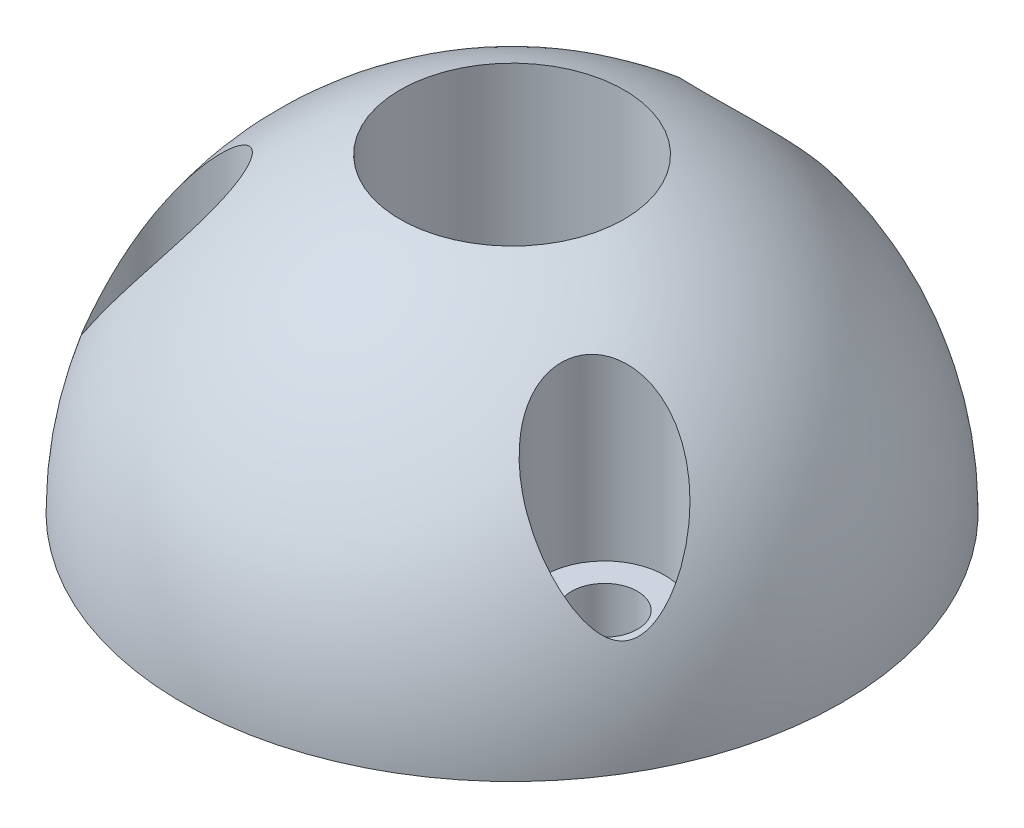
from build123d import *

# Parameters (mm, degrees)
CUT_EXTRUDE2_DEPTH = 3.5
SKETCH7_R          = 1.5
CUT_EXTRUDE6_DEPTH = 7
SKETCH3_R          = 5.1
CUT_EXTRUDE7_DEPTH = 25.129857024
CUT_EXTRUDE8_START = 4
SKETCH8_R          = 2.75
CUT_EXTRUDE8_DEPTH = 22.475282138


with BuildPart() as part:
    # Sketch1 → Revolve1 (revolve)
    with BuildSketch(Plane.XY):
        with BuildLine():
            ThreePointArc((0, 15), (-10.606601718, 10.606601718), (-15, 0))
            Line((-15, 0), (0, 0))
            Line((0, 0), (0, 15))
        make_face()
    revolve(axis=Axis((0, -1000, 0), (0, 1, 0)))

    # Sketch2 → Cut-Extrude2 (cut)
    with BuildSketch(Plane.XZ):
        Polygon((4.878609775, -8.45), (9.757219549, 0), (4.878609775, 8.45), (-4.878609775, 8.45), (-9.757219549, 0), (-4.878609775, -8.45), align=None)
    extrude(amount=-CUT_EXTRUDE2_DEPTH, mode=Mode.SUBTRACT)

    # Sketch7 → Cut-Extrude6 (cut)
    with BuildSketch(Plane.XZ):
        with Locations((-9.959292144, 5.75)):
            Circle(SKETCH7_R)
        with Locations((9.959292144, 5.75)):
            Circle(SKETCH7_R)
        with Locations((0, -11.5)):
            Circle(SKETCH7_R)
    extrude(amount=-CUT_EXTRUDE6_DEPTH, mode=Mode.SUBTRACT)

    # Sketch3 → Cut-Extrude7 (cut, through all)
    with BuildSketch(Plane.XZ.offset(-3.5)):
        Circle(SKETCH3_R)
    extrude(amount=-CUT_EXTRUDE7_DEPTH, mode=Mode.SUBTRACT)

    # Sketch8 → Cut-Extrude8 (cut, through all)
    with BuildSketch(Plane(origin=(0, 0, 0), x_dir=(1, 0, 0), z_dir=(0, 1, 0)).offset(CUT_EXTRUDE8_START)):
        with Locations((-9.959292144, -5.75)):
            Circle(SKETCH8_R)
        with Locations((0, 11.5)):
            Circle(SKETCH8_R)
        with Locations((9.959292144, -5.75)):
            Circle(SKETCH8_R)
    extrude(amount=CUT_EXTRUDE8_DEPTH, mode=Mode.SUBTRACT)


solid = part.part
